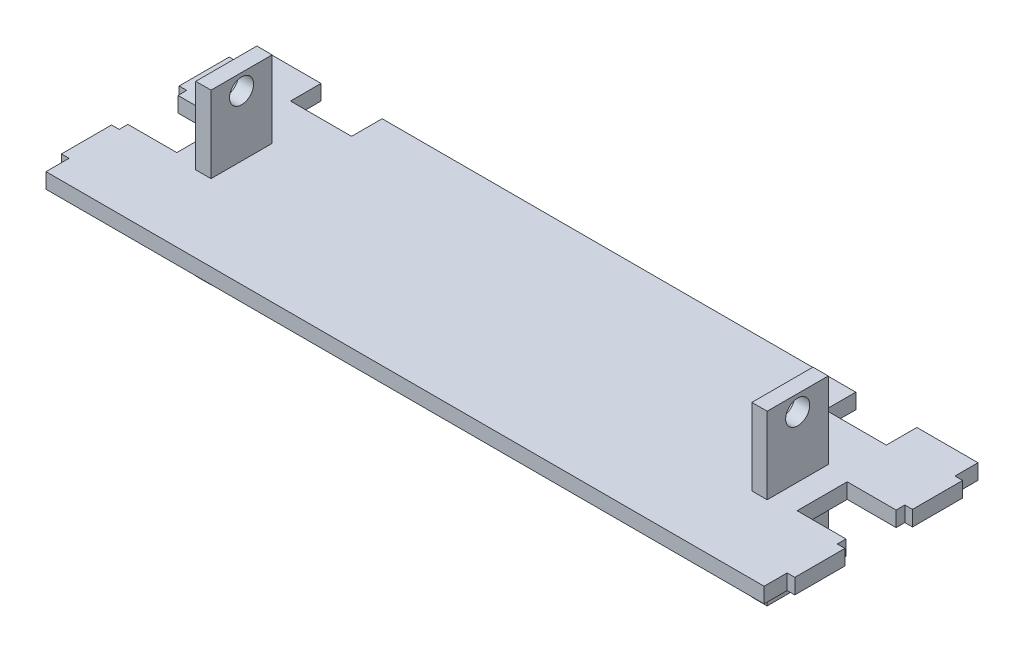
from build123d import *

# Parameters (mm, degrees)
BOSS_EXTRUDE1_DEPTH     = 3.175
SKETCH2_W               = 6.35
SKETCH2_H               = 25.4
BOSS_EXTRUDE2_DEPTH     = 35.052
CUT_EXTRUDE1_DEPTH      = 277.991076082
CUT_EXTRUDE1_DEPTH_BACK = 277.991076082
SKETCH5_R               = 5.0038


with BuildPart() as part:
    # Sketch1 → Boss-Extrude1 (new, symmetric)
    with BuildSketch(Plane(origin=(0, 0, 0), x_dir=(1, 0, 0), z_dir=(0, 1, 0))):
        Polygon((149.225, -44.45), (-149.225, -44.45), (-149.225, -34.874677354), (-152.4, -34.874677354), (-152.4, -14.046677354), (-149.225, -14.046677354), (-149.225, -10.414), (-128.905, -10.414), (-128.905, 10.414), (-149.225, 10.414), (-149.225, 14.046677354), (-152.4, 14.046677354), (-152.4, 34.874677354), (-149.225, 34.874677354), (-149.225, 44.45), (-123.825, 44.45), (-123.825, 31.75), (-98.425, 31.75), (-98.425, 44.45), (98.425, 44.45), (98.425, 31.75), (123.825, 31.75), (123.825, 44.45), (149.225, 44.45), (149.225, 34.874677354), (152.4, 34.874677354), (152.4, 14.046677354), (149.225, 14.046677354), (149.225, 10.414), (128.905, 10.414), (128.905, -10.414), (149.225, -10.414), (149.225, -14.046677354), (152.4, -14.046677354), (152.4, -34.874677354), (149.225, -34.874677354), align=None)
    extrude(amount=BOSS_EXTRUDE1_DEPTH, both=True)

    # Sketch2 → Boss-Extrude2 (add, symmetric)
    with BuildSketch(Plane(origin=(0, 0, 0), x_dir=(1, 0, 0), z_dir=(0, 1, 0))):
        with Locations((115.57, 0)):
            Rectangle(SKETCH2_W, SKETCH2_H)
        with Locations((-115.57, 0)):
            Rectangle(SKETCH2_W, SKETCH2_H)
    extrude(amount=BOSS_EXTRUDE2_DEPTH, both=True)

    # Sketch5 → Cut-Extrude1 (cut, two sides: drawn at the far end of the back side and taken through both)
    with BuildSketch(Plane.ZY.offset(118.745).offset(-CUT_EXTRUDE1_DEPTH_BACK)):
        with Locations((0, 28.448)):
            Circle(SKETCH5_R)
        with Locations((0, -28.448)):
            Circle(SKETCH5_R)
    extrude(amount=CUT_EXTRUDE1_DEPTH + CUT_EXTRUDE1_DEPTH_BACK, mode=Mode.SUBTRACT)


solid = part.part
